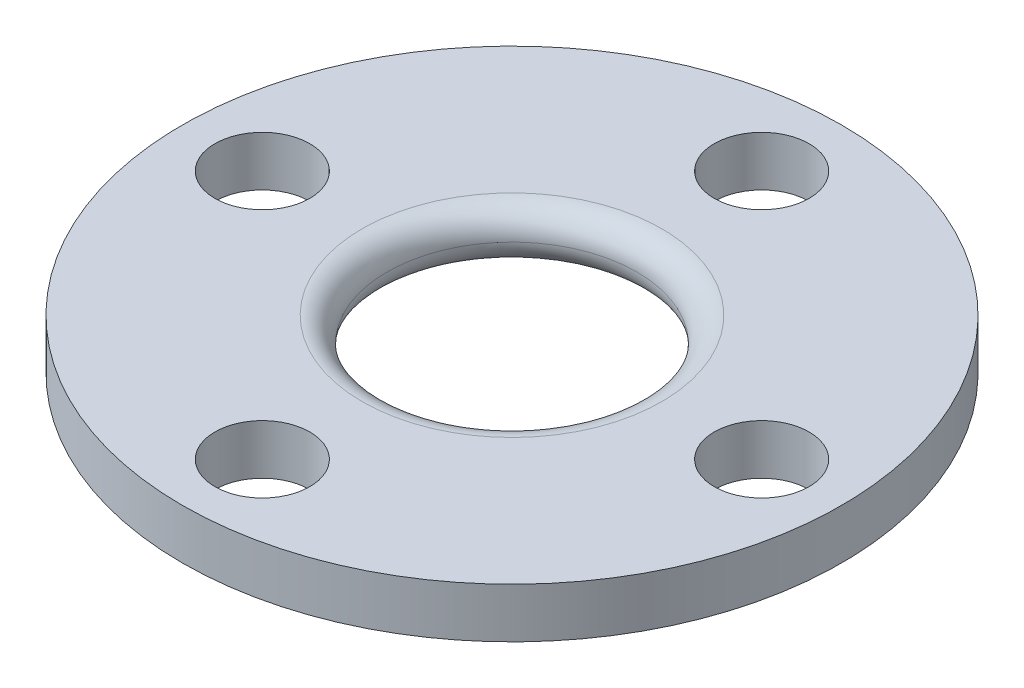
from build123d import *

# Parameters (mm, degrees)
SKETCH2_R           = 13.2
BOSS_EXTRUDE1_DEPTH = 2
SKETCH3_R           = 1.9
CUT_EXTRUDE1_DEPTH  = 2
SKETCH4_R           = 5
CUT_EXTRUDE2_DEPTH  = 2
CIRPATTERN1_COUNT   = 4
FILLET2_R           = 1


with BuildPart() as part:
    # Sketch2 → Boss-Extrude1 (new body)
    with BuildSketch(Plane(origin=(0, 0, 0), x_dir=(1, 0, 0), z_dir=(0, 1, 0))):
        with Locations(Location((0, 0, 0), (0, 0, 270))):
            Circle(SKETCH2_R)
    extrude(amount=BOSS_EXTRUDE1_DEPTH)

    # Sketch3 → Cut-Extrude1 (cut)
    with BuildSketch(Plane(origin=(0, 2, 0), x_dir=(1, 0, 0), z_dir=(0, 1, 0))):
        with Locations(Location((0, 10, 0), (0, 0, 270))):
            Circle(SKETCH3_R)
    cut_extrude1 = extrude(amount=-CUT_EXTRUDE1_DEPTH, mode=Mode.SUBTRACT)

    # Sketch4 → Cut-Extrude2 (cut)
    with BuildSketch(Plane(origin=(0, 2, 0), x_dir=(1, 0, 0), z_dir=(0, 1, 0))):
        with Locations(Location((0, 0, 0), (0, 0, 270))):
            Circle(SKETCH4_R)
    extrude(amount=-CUT_EXTRUDE2_DEPTH, mode=Mode.SUBTRACT)

    # CirPattern1: Cut-Extrude1 ×4 about axis
    cirpattern1_axis = Axis((0, 0, 0), (0, 1, 0))
    for i in range(1, CIRPATTERN1_COUNT):
        add(cut_extrude1.rotate(cirpattern1_axis, i * 360 / CIRPATTERN1_COUNT), mode=Mode.SUBTRACT)

    # Fillet2
    fillet2_edges = [part.edges().sort_by_distance(p)[0] for p in [
        (0, 0, -5),
        (0, 2, -5),
    ]]
    fillet(fillet2_edges, radius=FILLET2_R - 0.0001)  # a hair under: the kernel refuses the full size


solid = part.part
